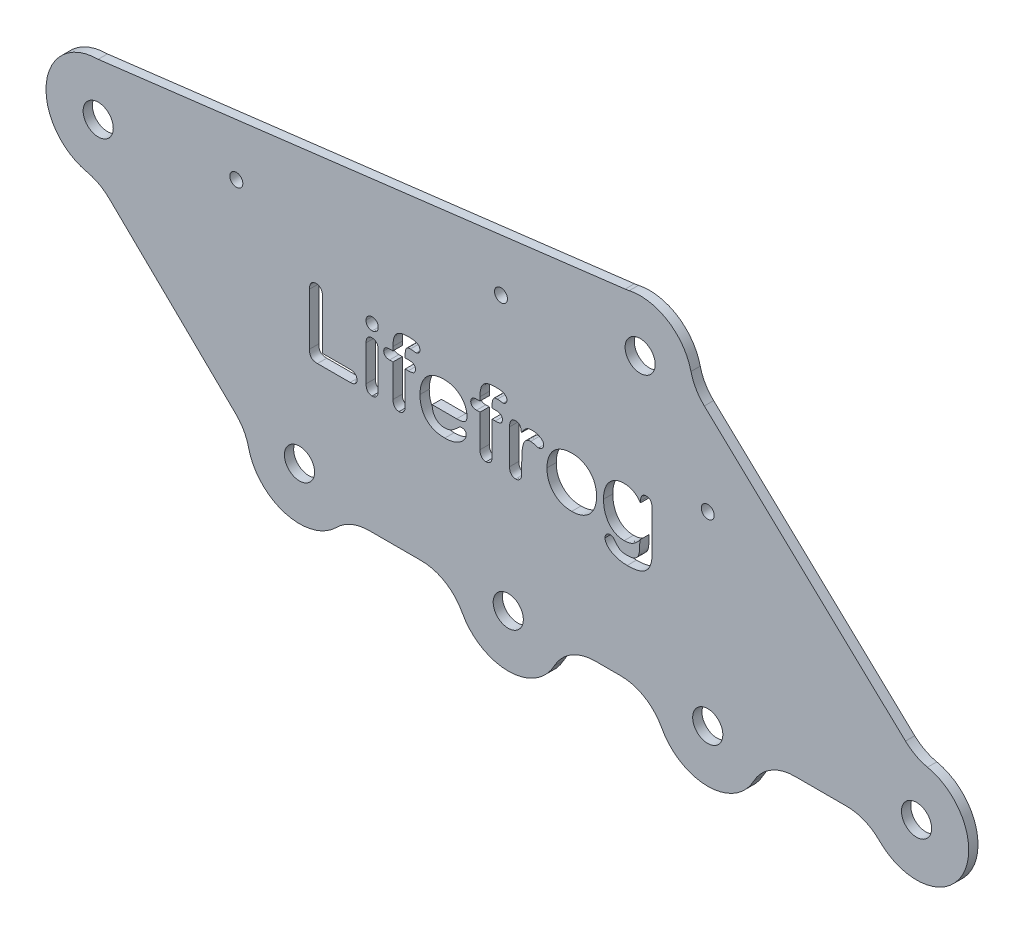
from build123d import *

# Parameters (mm, degrees)
SKETCH2_R               = 3.25
BOSS_EXTRUDE1_DEPTH     = 2
SKETCH7_R               = 1.4
CUT_EXTRUDE4_DEPTH      = 173.081521917
CUT_EXTRUDE5_DEPTH      = 173.081521917
CUT_EXTRUDE5_DEPTH_BACK = 173.081521917
SKETCH8_R               = 4.120030103
SKETCH8_R_2             = 3.620945825
CUT_EXTRUDE6_DEPTH      = 10


with BuildPart() as part:
    # Sketch2 → Boss-Extrude1 (new body)
    with BuildSketch(Plane.XY):
        with BuildLine():
            Line((-148.073115296, -13.584682462), (-120.825231203, -40.096785488))
            ThreePointArc((-120.825231203, -40.096785488), (-119.081817876, -42.363650366), (-118.051299446, -45.031270685))
            ThreePointArc((-118.051299446, -45.031270685), (-110.186182808, -53.333696022), (-99.116582089, -50.460672154))
            ThreePointArc((-99.116582089, -50.460672154), (-95.868116105, -48.284014232), (-92.03329116, -47.519495684))
            Line((-92.03329116, -47.519495684), (-80.835284384, -47.519495684))
            ThreePointArc((-80.835284384, -47.519495684), (-75.69032683, -48.944566427), (-72.011754972, -52.813613331))
            ThreePointArc((-72.011754972, -52.813613331), (-62.085284384, -58.769495684), (-52.158813796, -52.813613331))
            ThreePointArc((-52.158813796, -52.813613331), (-48.480241938, -48.944566427), (-43.335284384, -47.519495684))
            Line((-43.335284384, -47.519495684), (-37.835284384, -47.519495684))
            ThreePointArc((-37.835284384, -47.519495684), (-32.69032683, -48.944566427), (-29.011754972, -52.813613331))
            ThreePointArc((-29.011754972, -52.813613331), (-19.085284384, -58.769495684), (-9.158813796, -52.813613331))
            ThreePointArc((-9.158813796, -52.813613331), (-5.480241938, -48.944566427), (-0.335284384, -47.519495684))
            Line((-0.335284384, -47.519495684), (10.862722393, -47.519495684))
            ThreePointArc((10.862722393, -47.519495684), (14.697547337, -48.284014232), (17.946013321, -50.460672154))
            ThreePointArc((17.946013321, -50.460672154), (35.789142951, -47.910060108), (28.284854849, -31.521998695))
            ThreePointArc((28.284854849, -31.521998695), (25.737103371, -30.597165541), (23.531291017, -29.022127188))
            Line((23.531291017, -29.022127188), (-19.826212646, 11.860344126))
            ThreePointArc((-19.826212646, 11.860344126), (-21.632423973, 14.14697339), (-22.70275091, 16.857226699))
            ThreePointArc((-22.70275091, 16.857226699), (-27.630580825, 23.793458302), (-36.00543315, 25.295678347))
            ThreePointArc((-36.00543315, 25.295678347), (-36.440399397, 25.212847446), (-36.878605966, 25.149352578))
            Line((-36.878605966, 25.149352578), (-150.472591379, 11.25))
            ThreePointArc((-150.472591379, 11.25), (-161.656466294, 1.217966296), (-152.894206081, -10.986276996))
            ThreePointArc((-152.894206081, -10.986276996), (-150.302310001, -11.949001015), (-148.073115296, -13.584682462))
        make_face()
        with Locations((25.914715616, -42.519495684)):
            Circle(SKETCH2_R, mode=Mode.SUBTRACT)
        with Locations((-19.085284384, -47.519495684)):
            Circle(SKETCH2_R, mode=Mode.SUBTRACT)
        with Locations((-62.085284384, -47.519495684)):
            Circle(SKETCH2_R, mode=Mode.SUBTRACT)
        with Locations((-107.085284384, -42.519495684)):
            Circle(SKETCH2_R, mode=Mode.SUBTRACT)
        with Locations((-150.472591379, 0)):
            Circle(SKETCH2_R, mode=Mode.SUBTRACT)
        with Locations((-33.656755, 14.29357805)):
            Circle(SKETCH2_R, mode=Mode.SUBTRACT)
    extrude(amount=BOSS_EXTRUDE1_DEPTH)

    # Sketch7 → Cut-Extrude4 (cut, through all)
    with BuildSketch(Plane.XY.offset(2)):
        with Locations((-120.694679945, 3.643623283)):
            Circle(SKETCH7_R)
        with Locations((-63.656755, 10.622780025)):
            Circle(SKETCH7_R)
        with Locations((-19.085284384, -7.519495684)):
            Circle(SKETCH7_R)
    extrude(amount=-CUT_EXTRUDE4_DEPTH, mode=Mode.SUBTRACT)

    # Sketch5 → Cut-Extrude5 (cut, two sides: drawn at the far end of the back side and taken through both)
    # profile 1 of 9: a face of its own
    with BuildSketch(Plane.XY.offset(2).offset(-CUT_EXTRUDE5_DEPTH_BACK)):
        with BuildLine():
            Line((-102.115894244, -8.88917677), (-102.115894244, -19.477067395))
            Line((-102.115894244, -19.477067395), (-96.162769244, -19.477067395))
            add(Edge.make_bspline(
                [(-96.162769244, -19.477067395), (-96.051007313, -19.479993195), (-95.837884188, -19.485572515), (-95.539916783, -19.554542719), (-95.278875028, -19.661257744), (-95.067813968, -19.819951832), (-94.897692681, -20.005566477), (-94.774137444, -20.217869304), (-94.701867925, -20.454899643), (-94.69344353, -20.620129964), (-94.689136431, -20.704606457)],
                knots=[0, 0, 0, 0, 1.240270116, 2.365118784, 3.381765818, 4.352609133, 5.275186246, 6.165500839, 7.062084633, 8, 8, 8, 8], degree=3))
            add(Edge.make_bspline(
                [(-94.689136431, -20.704606457), (-94.693268201, -20.791061883), (-94.701260642, -20.958300126), (-94.774223839, -21.197153566), (-94.896313466, -21.407864411), (-95.064278317, -21.589554136), (-95.275076024, -21.739731647), (-95.534926018, -21.839448431), (-95.834238111, -21.905877279), (-96.049070498, -21.911559901), (-96.162769244, -21.914567395)],
                knots=[0, 0, 0, 0, 0.961785517, 1.860465312, 2.752861249, 3.654173772, 4.599371787, 5.609990076, 6.735101654, 8, 8, 8, 8], degree=3))
            Line((-96.162769244, -21.914567395), (-103.205737994, -21.914567395))
            add(Edge.make_bspline(
                [(-103.205737994, -21.914567395), (-103.348861132, -21.910822677), (-103.615411062, -21.903848583), (-103.983050705, -21.820051925), (-104.292130258, -21.691568649), (-104.538399287, -21.496286799), (-104.719909675, -21.2361672), (-104.844114456, -20.915092293), (-104.914328704, -20.530846545), (-104.923491067, -20.25471837), (-104.928394244, -20.106950207)],
                knots=[0, 0, 0, 0, 1.184943227, 2.206816713, 3.109923682, 3.939837529, 4.776053014, 5.71019795, 6.774627611, 8, 8, 8, 8], degree=3))
            Line((-104.928394244, -20.106950207), (-104.928394244, -8.88917677))
            add(Edge.make_bspline(
                [(-104.928394244, -8.88917677), (-104.924770448, -8.749162056), (-104.917946116, -8.485486372), (-104.845257533, -8.118037422), (-104.725580552, -7.804802622), (-104.557073154, -7.546892469), (-104.345359797, -7.348035389), (-104.103133358, -7.202614303), (-103.828238086, -7.118889739), (-103.635988236, -7.107793002), (-103.536792681, -7.102067395)],
                knots=[0, 0, 0, 0, 1.312227502, 2.471186598, 3.495416453, 4.440711492, 5.33513045, 6.197779038, 7.0701043, 8, 8, 8, 8], degree=3))
            add(Edge.make_bspline(
                [(-103.536792681, -7.102067395), (-103.435486672, -7.106162598), (-103.238729888, -7.114116312), (-102.960533725, -7.204196573), (-102.711018875, -7.34317393), (-102.496727467, -7.541754535), (-102.319699564, -7.795771782), (-102.199312355, -8.111096688), (-102.125957592, -8.481501141), (-102.119399349, -8.747181708), (-102.115894244, -8.88917677)],
                knots=[0, 0, 0, 0, 0.937651975, 1.821110013, 2.686129292, 3.571911612, 4.510265029, 5.535848738, 6.683015045, 8, 8, 8, 8], degree=3))
        make_face()
    # profile 2 of 9: a face of its own
    with BuildSketch(Plane.XY.offset(2).offset(-CUT_EXTRUDE5_DEPTH_BACK)):
        with BuildLine():
            Line((-90.115894244, -12.74464552), (-90.115894244, -20.476090832))
            add(Edge.make_bspline(
                [(-90.115894244, -20.476090832), (-90.119794378, -20.602435528), (-90.127150905, -20.84074997), (-90.197032734, -21.174236118), (-90.314116621, -21.460321774), (-90.479508659, -21.694972614), (-90.682688675, -21.876468441), (-90.91257444, -22.009165841), (-91.170561441, -22.087195916), (-91.35072121, -22.097028675), (-91.443042681, -22.102067395)],
                knots=[0, 0, 0, 0, 1.279660949, 2.41372764, 3.434282009, 4.393028164, 5.297478756, 6.175532382, 7.06506577, 8, 8, 8, 8], degree=3))
            add(Edge.make_bspline(
                [(-91.443042681, -22.102067395), (-91.535510198, -22.097531408), (-91.714376796, -22.08875712), (-91.96856286, -22.004912745), (-92.195763486, -21.871389965), (-92.391201556, -21.682373157), (-92.551255931, -21.445866625), (-92.661127298, -21.160395096), (-92.729043835, -20.832780478), (-92.736793903, -20.599508451), (-92.740894244, -20.476090832)],
                knots=[0, 0, 0, 0, 0.944656094, 1.82731652, 2.710883517, 3.62364324, 4.589202842, 5.612771424, 6.736985008, 8, 8, 8, 8], degree=3))
            Line((-92.740894244, -20.476090832), (-92.740894244, -12.823747082))
            add(Edge.make_bspline(
                [(-92.740894244, -12.823747082), (-92.736699871, -12.699382119), (-92.728769083, -12.464230884), (-92.662517274, -12.136087305), (-92.551799881, -11.854229206), (-92.391012747, -11.625466775), (-92.194397213, -11.44586487), (-91.968144037, -11.317596829), (-91.713355602, -11.241954113), (-91.535359197, -11.232151465), (-91.443042681, -11.227067395)],
                knots=[0, 0, 0, 0, 1.282601348, 2.425162879, 3.437763456, 4.38569495, 5.284727511, 6.164859808, 7.048218153, 8, 8, 8, 8], degree=3))
            add(Edge.make_bspline(
                [(-91.443042681, -11.227067395), (-91.350780374, -11.232364163), (-91.171013808, -11.242684541), (-90.912920439, -11.316791228), (-90.682617286, -11.446472242), (-90.482415238, -11.624386887), (-90.315350707, -11.846010703), (-90.198859156, -12.112795725), (-90.127488314, -12.416719887), (-90.119879855, -12.631916842), (-90.115894244, -12.74464552)],
                knots=[0, 0, 0, 0, 0.975882645, 1.901438153, 2.812865763, 3.75006033, 4.717368935, 5.725761173, 6.808663735, 8, 8, 8, 8], degree=3))
        make_face()
    # profile 3 of 9: a face of its own
    with BuildSketch(Plane.XY.offset(2).offset(-CUT_EXTRUDE5_DEPTH_BACK)):
        with BuildLine():
            add(Edge.make_bspline(
                [(-91.413745806, -9.914567395), (-91.502059692, -9.911112501), (-91.674377381, -9.904371326), (-91.923091601, -9.837014704), (-92.15078929, -9.726888524), (-92.357720239, -9.578448802), (-92.529720608, -9.386651845), (-92.655762931, -9.154497095), (-92.729492495, -8.885778489), (-92.73699213, -8.695310105), (-92.740894244, -8.59620802)],
                knots=[0, 0, 0, 0, 1.006201835, 1.963296869, 2.915511555, 3.880878732, 4.85189213, 5.829536295, 6.870691953, 8, 8, 8, 8], degree=3))
            add(Edge.make_bspline(
                [(-92.740894244, -8.59620802), (-92.735711958, -8.504891338), (-92.725668701, -8.327919822), (-92.650545078, -8.073896193), (-92.521388078, -7.848246813), (-92.347766447, -7.652100465), (-92.141388488, -7.494003153), (-91.916161531, -7.371969471), (-91.66963809, -7.303278473), (-91.500084931, -7.29419357), (-91.413745806, -7.289567395)],
                knots=[0, 0, 0, 0, 1.057408726, 2.04925565, 3.037480321, 4.047814229, 5.064214746, 6.036169889, 6.999986943, 8, 8, 8, 8], degree=3))
            add(Edge.make_bspline(
                [(-91.413745806, -7.289567395), (-91.330331688, -7.293289281), (-91.166969837, -7.300578386), (-90.929246738, -7.365176401), (-90.707981257, -7.471719022), (-90.506122496, -7.61868617), (-90.327667655, -7.801949122), (-90.205863506, -8.035133325), (-90.125225569, -8.302838261), (-90.119114728, -8.494958443), (-90.115894244, -8.59620802)],
                knots=[0, 0, 0, 0, 0.967133894, 1.894077239, 2.837452275, 3.803721558, 4.782485793, 5.777084342, 6.828497526, 8, 8, 8, 8], degree=3))
            add(Edge.make_bspline(
                [(-90.115894244, -8.59620802), (-90.119666741, -8.694407685), (-90.126915601, -8.883098506), (-90.202445242, -9.148438196), (-90.323346226, -9.381879948), (-90.497008149, -9.571319036), (-90.697722159, -9.722899361), (-90.920078487, -9.833786351), (-91.160369106, -9.904963009), (-91.328281937, -9.911327839), (-91.413745806, -9.914567395)],
                knots=[0, 0, 0, 0, 1.133982342, 2.178948973, 3.165031597, 4.149752721, 5.126395816, 6.06160272, 7.013399203, 8, 8, 8, 8], degree=3))
        make_face()
    # profile 4 of 9: a face of its own
    with BuildSketch(Plane.XY.offset(2).offset(-CUT_EXTRUDE5_DEPTH_BACK)):
        with BuildLine():
            Line((-87.569995806, -11.414567395), (-86.928394244, -11.414567395))
            Line((-86.928394244, -11.414567395), (-86.928394244, -10.591325207))
            add(Edge.make_bspline(
                [(-86.928394244, -10.591325207), (-86.924700914, -10.388045332), (-86.917705381, -10.00301306), (-86.859665412, -9.457909943), (-86.765573069, -8.978381027), (-86.632882133, -8.557808501), (-86.446581198, -8.195572563), (-86.205604775, -7.887535194), (-85.908437152, -7.633608774), (-85.553484837, -7.431434885), (-85.135146039, -7.280410479), (-84.649682076, -7.174729198), (-84.094123419, -7.111487828), (-83.700058626, -7.105323868), (-83.491870806, -7.102067395)],
                knots=[0, 0, 0, 0, 1.272338929, 2.409936283, 3.426662608, 4.327577154, 5.161578725, 5.96266415, 6.760383261, 7.592994418, 8.506024445, 9.533847079, 10.697110196, 12, 12, 12, 12], degree=3))
            add(Edge.make_bspline(
                [(-83.491870806, -7.102067395), (-83.307068191, -7.104261268), (-82.960801066, -7.108371958), (-82.478567661, -7.168286024), (-82.066452312, -7.255167266), (-81.72918291, -7.391161667), (-81.457325514, -7.558653085), (-81.264450259, -7.776533401), (-81.14794255, -8.037027657), (-81.134555018, -8.223910447), (-81.127612994, -8.320817395)],
                knots=[0, 0, 0, 0, 1.495564663, 2.802259462, 3.930374803, 4.895312065, 5.735498063, 6.492167842, 7.218122695, 8, 8, 8, 8], degree=3))
            add(Edge.make_bspline(
                [(-81.127612994, -8.320817395), (-81.13016044, -8.384563693), (-81.135172155, -8.509974928), (-81.182649106, -8.690669099), (-81.264942883, -8.855101057), (-81.371125512, -9.002344218), (-81.498609867, -9.125761707), (-81.641283549, -9.215318606), (-81.796289851, -9.272564588), (-81.904462105, -9.278650351), (-81.959644244, -9.281754895)],
                knots=[0, 0, 0, 0, 1.08569999, 2.135951137, 3.156332465, 4.20565892, 5.218674748, 6.161348951, 7.062045096, 8, 8, 8, 8], degree=3))
            add(Edge.make_bspline(
                [(-81.959644244, -9.281754895), (-81.990923875, -9.281243662), (-82.062451162, -9.280074624), (-82.184322966, -9.265550853), (-82.335069813, -9.249871502), (-82.562596635, -9.213428957), (-82.838380297, -9.175272517), (-83.05620293, -9.167906783), (-83.154956744, -9.164567395)],
                knots=[0, 0, 0, 0, 0.468218035, 1.070676523, 1.83620524, 2.737967929, 4.521099009, 6, 6, 6, 6], degree=3))
            add(Edge.make_bspline(
                [(-83.154956744, -9.164567395), (-83.266879767, -9.168513751), (-83.471705369, -9.175735811), (-83.748826522, -9.253609551), (-83.965776352, -9.387787922), (-84.108374405, -9.587280743), (-84.19515756, -9.82836939), (-84.25744231, -10.108223991), (-84.299579902, -10.432859402), (-84.302069643, -10.66441903), (-84.303394244, -10.78761427)],
                knots=[0, 0, 0, 0, 1.158634456, 2.120368021, 2.955008234, 3.751380872, 4.611223429, 5.599229928, 6.722733105, 8, 8, 8, 8], degree=3))
            Line((-84.303394244, -10.78761427), (-84.303394244, -11.414567395))
            Line((-84.303394244, -11.414567395), (-83.638355181, -11.414567395))
            add(Edge.make_bspline(
                [(-83.638355181, -11.414567395), (-83.518035883, -11.416649074), (-83.291972191, -11.420560268), (-82.976422378, -11.467875581), (-82.70599729, -11.540251074), (-82.484005335, -11.648680399), (-82.308648107, -11.789413733), (-82.185554218, -11.965226471), (-82.107884225, -12.172143548), (-82.10096014, -12.32106946), (-82.097339556, -12.398942395)],
                knots=[0, 0, 0, 0, 1.396050608, 2.622990337, 3.6962846, 4.634546857, 5.472373731, 6.277878481, 7.09950757, 8, 8, 8, 8], degree=3))
            add(Edge.make_bspline(
                [(-82.097339556, -12.398942395), (-82.101430239, -12.506003658), (-82.10888127, -12.701011923), (-82.184683124, -12.965095468), (-82.314039334, -13.171513058), (-82.509943835, -13.302589493), (-82.740907301, -13.37783369), (-83.005840503, -13.437731598), (-83.309405986, -13.470942071), (-83.525001195, -13.474956644), (-83.638355181, -13.477067395)],
                knots=[0, 0, 0, 0, 1.171181197, 2.133264703, 2.982673099, 3.781862637, 4.659228062, 5.636037739, 6.757094158, 8, 8, 8, 8], degree=3))
            Line((-83.638355181, -13.477067395), (-84.303394244, -13.477067395))
            Line((-84.303394244, -13.477067395), (-84.303394244, -20.49073927))
            add(Edge.make_bspline(
                [(-84.303394244, -20.49073927), (-84.307324323, -20.614179922), (-84.314789501, -20.848655192), (-84.385280454, -21.176561155), (-84.498848793, -21.461585314), (-84.664152095, -21.695052259), (-84.866845108, -21.875428653), (-85.095501488, -22.010618694), (-85.355317063, -22.086940159), (-85.537294849, -22.096942211), (-85.630542681, -22.102067395)],
                knots=[0, 0, 0, 0, 1.256538349, 2.386792053, 3.399650087, 4.363398215, 5.272567509, 6.146574889, 7.050280375, 8, 8, 8, 8], degree=3))
            add(Edge.make_bspline(
                [(-85.630542681, -22.102067395), (-85.719989993, -22.09710813), (-85.894515188, -22.087431855), (-86.145054229, -22.007724342), (-86.370556982, -21.876461922), (-86.570766574, -21.694722042), (-86.732567229, -21.460721404), (-86.846686793, -21.176665365), (-86.916946166, -20.8486244), (-86.924445947, -20.614169302), (-86.928394244, -20.49073927)],
                knots=[0, 0, 0, 0, 0.920542794, 1.796117823, 2.680158831, 3.592296685, 4.561321835, 5.585807508, 6.729036556, 8, 8, 8, 8], degree=3))
            Line((-86.928394244, -20.49073927), (-86.928394244, -13.477067395))
            Line((-86.928394244, -13.477067395), (-87.669605181, -13.477067395))
            add(Edge.make_bspline(
                [(-87.669605181, -13.477067395), (-87.764717637, -13.474545828), (-87.945069974, -13.469764431), (-88.197602841, -13.411306638), (-88.420159882, -13.326305771), (-88.603573939, -13.197615767), (-88.750908304, -13.041843238), (-88.850169927, -12.858126156), (-88.916372739, -12.656347119), (-88.923007314, -12.513757181), (-88.926441119, -12.43995802)],
                knots=[0, 0, 0, 0, 1.239726906, 2.350771435, 3.369360947, 4.331849643, 5.252604265, 6.143447782, 7.039118766, 8, 8, 8, 8], degree=3))
            add(Edge.make_bspline(
                [(-88.926441119, -12.43995802), (-88.923283957, -12.359364997), (-88.9172753, -12.205981751), (-88.850749549, -11.99217143), (-88.742401324, -11.809230275), (-88.589026748, -11.659732473), (-88.391857426, -11.547566221), (-88.154756492, -11.470404208), (-87.876811847, -11.419710271), (-87.676697567, -11.416355939), (-87.569995806, -11.414567395)],
                knots=[0, 0, 0, 0, 0.995382564, 1.894394861, 2.740686784, 3.604514537, 4.515167111, 5.524921804, 6.68027808, 8, 8, 8, 8], degree=3))
        make_face()
    # profile 5 of 9: a face of its own
    with BuildSketch(Plane.XY.offset(2).offset(-CUT_EXTRUDE5_DEPTH_BACK)):
        with BuildLine():
            Line((-73.208667681, -17.227067395), (-78.490894244, -17.227067395))
            add(Edge.make_bspline(
                [(-78.490894244, -17.227067395), (-78.485729032, -17.373895282), (-78.475607796, -17.661604604), (-78.399500086, -18.07799563), (-78.286354508, -18.469071713), (-78.128567635, -18.829619398), (-77.931660235, -19.153364248), (-77.709449566, -19.442705533), (-77.451707834, -19.684973297), (-77.165756761, -19.88267243), (-76.856444567, -20.033615445), (-76.531732066, -20.148105778), (-76.18967889, -20.212156224), (-75.956959932, -20.222066531), (-75.839527056, -20.227067395)],
                knots=[0, 0, 0, 0, 1.179639705, 2.311504614, 3.392005435, 4.44652888, 5.46432702, 6.431680492, 7.370191764, 8.295643874, 9.215452015, 10.129041871, 11.055891293, 12, 12, 12, 12], degree=3))
            add(Edge.make_bspline(
                [(-75.839527056, -20.227067395), (-75.684899945, -20.221290078), (-75.38699415, -20.210159454), (-74.953894078, -20.128402077), (-74.55183901, -19.976572402), (-74.172233727, -19.770423211), (-73.819626408, -19.521193305), (-73.535198858, -19.296133613), (-73.30788746, -19.094787244), (-73.116419912, -18.918875484), (-72.897546603, -18.722900775), (-72.746482696, -18.581855292), (-72.666675494, -18.507340832)],
                knots=[0, 0, 0, 0, 1.247905556, 2.404224554, 3.538983975, 4.702801183, 5.881313568, 7.020008393, 7.628790321, 8.331868978, 9.11872483, 10, 10, 10, 10], degree=3))
            add(Edge.make_bspline(
                [(-72.666675494, -18.507340832), (-72.629561272, -18.48027204), (-72.552305707, -18.423926662), (-72.410745358, -18.369543996), (-72.248164227, -18.338198915), (-72.132654468, -18.333846809), (-72.071948931, -18.331559582)],
                knots=[0, 0, 0, 0, 0.868866131, 1.808598965, 2.848320883, 4, 4, 4, 4], degree=3))
            add(Edge.make_bspline(
                [(-72.071948931, -18.331559582), (-72.005205088, -18.333900139), (-71.877920585, -18.33836372), (-71.698147996, -18.385198991), (-71.535535781, -18.453914722), (-71.397435702, -18.559309462), (-71.281141949, -18.686697731), (-71.200775579, -18.843467551), (-71.148932879, -19.021621344), (-71.145191899, -19.149522649), (-71.143237994, -19.216325207)],
                knots=[0, 0, 0, 0, 1.102465736, 2.102468148, 3.057950005, 4.00546365, 4.956145095, 5.889200524, 6.897534264, 8, 8, 8, 8], degree=3))
            add(Edge.make_bspline(
                [(-71.143237994, -19.216325207), (-71.147074427, -19.281058441), (-71.155207149, -19.418284177), (-71.211530831, -19.630580971), (-71.30468497, -19.856403047), (-71.430534653, -20.095129398), (-71.589870145, -20.341196211), (-71.792561168, -20.580823639), (-72.027283373, -20.819411181), (-72.299993333, -21.049528185), (-72.606870884, -21.269822809), (-72.952879871, -21.470546591), (-73.33797498, -21.646257285), (-73.755957021, -21.809324299), (-74.209350401, -21.941257019), (-74.697887614, -22.0333954), (-75.217872478, -22.094193404), (-75.576651345, -22.099400308), (-75.760425494, -22.102067395)],
                knots=[0, 0, 0, 0, 0.525537938, 1.114069654, 1.772306998, 2.506549159, 3.302753817, 4.147512317, 5.050313588, 6.017967943, 7.041213872, 8.114344659, 9.260276936, 10.47524946, 11.755151616, 13.087980653, 14.508401902, 16, 16, 16, 16], degree=3))
            add(Edge.make_bspline(
                [(-75.760425494, -22.102067395), (-75.970566234, -22.097519737), (-76.380250285, -22.088653761), (-76.975430681, -22.021353682), (-77.533004004, -21.908362258), (-78.051645226, -21.745772772), (-78.534701665, -21.542562166), (-78.978161462, -21.288395048), (-79.381535863, -20.987522623), (-79.746754804, -20.64373407), (-80.067772398, -20.257975864), (-80.351874822, -19.841633038), (-80.585884137, -19.388813691), (-80.780372736, -18.905299727), (-80.932098867, -18.389217889), (-81.040075091, -17.840151988), (-81.10545073, -17.258936562), (-81.112357264, -16.86005426), (-81.115894244, -16.655778332)],
                knots=[0, 0, 0, 0, 1.161895415, 2.265196273, 3.307380836, 4.303185105, 5.266158709, 6.199917451, 7.122316156, 8.043005893, 8.966794753, 9.89246016, 10.824859252, 11.779559524, 12.770652002, 13.794812853, 14.87067777, 16, 16, 16, 16], degree=3))
            add(Edge.make_bspline(
                [(-81.115894244, -16.655778332), (-81.112351374, -16.462226663), (-81.105370439, -16.080848933), (-81.038259091, -15.519624607), (-80.933763598, -14.979723953), (-80.788486547, -14.462108781), (-80.598046656, -13.975533109), (-80.372921593, -13.519340339), (-80.104117762, -13.102077052), (-79.799927638, -12.718106315), (-79.451233704, -12.376213514), (-79.061234287, -12.074737303), (-78.628998548, -11.817183613), (-78.157129599, -11.603132446), (-77.650787767, -11.433045112), (-77.112381625, -11.315293392), (-76.545831122, -11.238702527), (-76.158145954, -11.231007425), (-75.959644244, -11.227067395)],
                knots=[0, 0, 0, 0, 1.095507523, 2.15860795, 3.195309999, 4.206995944, 5.197887526, 6.149926361, 7.082497361, 8.003040645, 8.917987058, 9.840388418, 10.787726911, 11.760164811, 12.769081724, 13.806049167, 14.876658106, 16, 16, 16, 16], degree=3))
            add(Edge.make_bspline(
                [(-75.959644244, -11.227067395), (-75.82967599, -11.22810589), (-75.575169739, -11.23013949), (-75.200806959, -11.265268194), (-74.839711595, -11.313850777), (-74.491487894, -11.382379075), (-74.15967654, -11.478141357), (-73.841160582, -11.589179566), (-73.536096258, -11.720379466), (-73.247093024, -11.874248291), (-72.971225393, -12.038773815), (-72.717190296, -12.223475089), (-72.475441109, -12.411434191), (-72.254440606, -12.616494045), (-72.04918298, -12.831425773), (-71.86543806, -13.06140635), (-71.695754099, -13.299708893), (-71.501065769, -13.632045496), (-71.29721699, -14.058699678), (-71.115470707, -14.582630241), (-71.005629179, -15.115069491), (-70.991884998, -15.472667779), (-70.985034869, -15.65089552)],
                knots=[0, 0, 0, 0, 1.048847282, 2.053872234, 3.03283051, 3.989924751, 4.915857681, 5.818505585, 6.711913066, 7.593554535, 8.460263899, 9.302531452, 10.127499996, 10.930978608, 11.734070318, 12.524563272, 13.305443929, 14.093732096, 15.631266151, 17.114748765, 18.561984696, 20, 20, 20, 20], degree=3))
            add(Edge.make_bspline(
                [(-70.985034869, -15.65089552), (-70.986604018, -15.730068621), (-70.989597069, -15.881086234), (-71.015277956, -16.097314554), (-71.061442947, -16.291180146), (-71.127161718, -16.464024902), (-71.206726919, -16.617172785), (-71.3094301, -16.74579461), (-71.428239515, -16.854326494), (-71.620032975, -16.968584464), (-71.901445225, -17.07492862), (-72.285671015, -17.164445981), (-72.727625927, -17.219117531), (-73.042486482, -17.224321026), (-73.208667681, -17.227067395)],
                knots=[0, 0, 0, 0, 0.899856074, 1.716417764, 2.470354694, 3.159019517, 3.814679391, 4.423252287, 5.02068589, 5.633798556, 6.949059873, 8.421953477, 10.111532063, 12, 12, 12, 12], degree=3))
        make_face()
        with BuildLine():
            Line((-78.490894244, -15.727067395), (-73.595386431, -15.727067395))
            add(Edge.make_bspline(
                [(-73.595386431, -15.727067395), (-73.604322953, -15.620388862), (-73.621708392, -15.412852503), (-73.676971373, -15.113999216), (-73.741925544, -14.835108466), (-73.828072086, -14.577543089), (-73.929671959, -14.341165405), (-74.047709808, -14.123236857), (-74.184828665, -13.928050969), (-74.338373242, -13.753386376), (-74.507240019, -13.600302554), (-74.687703579, -13.465060191), (-74.88367525, -13.352382039), (-75.092871169, -13.262997606), (-75.31249975, -13.187447347), (-75.546992381, -13.140138129), (-75.792574806, -13.105158478), (-75.961461832, -13.103110926), (-76.047534869, -13.102067395)],
                knots=[0, 0, 0, 0, 1.274652096, 2.479755284, 3.617009281, 4.684005428, 5.71065458, 6.679155714, 7.63137599, 8.546404667, 9.444107911, 10.342338794, 11.228430864, 12.129821099, 13.049645363, 13.989847955, 14.975528821, 16, 16, 16, 16], degree=3))
            add(Edge.make_bspline(
                [(-76.047534869, -13.102067395), (-76.129637456, -13.10475237), (-76.290452304, -13.110011447), (-76.527254178, -13.138599654), (-76.752039842, -13.191199261), (-76.965729073, -13.265652746), (-77.168337697, -13.359118289), (-77.35978224, -13.474146939), (-77.539458013, -13.609700616), (-77.706839063, -13.766189336), (-77.862846038, -13.941320054), (-78.000334453, -14.138573533), (-78.120382782, -14.355594311), (-78.229866787, -14.589561112), (-78.320263624, -14.845787112), (-78.392374485, -15.122470817), (-78.451283959, -15.417941176), (-78.477480377, -15.622383021), (-78.490894244, -15.727067395)],
                knots=[0, 0, 0, 0, 0.988988761, 1.937138454, 2.867098831, 3.763434994, 4.657917626, 5.549380048, 6.447873833, 7.363218941, 8.304708192, 9.267190604, 10.251834605, 11.288414524, 12.374576878, 13.518478699, 14.729337904, 16, 16, 16, 16], degree=3))
        make_face(mode=Mode.SUBTRACT)
    # profile 6 of 9: a face of its own
    with BuildSketch(Plane.XY.offset(2).offset(-CUT_EXTRUDE5_DEPTH_BACK)):
        with BuildLine():
            Line((-68.819995806, -11.414567395), (-68.178394244, -11.414567395))
            Line((-68.178394244, -11.414567395), (-68.178394244, -10.591325207))
            add(Edge.make_bspline(
                [(-68.178394244, -10.591325207), (-68.174700914, -10.388045332), (-68.167705381, -10.00301306), (-68.109665412, -9.457909943), (-68.015573069, -8.978381027), (-67.882882133, -8.557808501), (-67.696581198, -8.195572563), (-67.455604775, -7.887535194), (-67.158437152, -7.633608774), (-66.803484837, -7.431434885), (-66.385146039, -7.280410479), (-65.899682076, -7.174729198), (-65.344123419, -7.111487828), (-64.950058626, -7.105323868), (-64.741870806, -7.102067395)],
                knots=[0, 0, 0, 0, 1.272338929, 2.409936283, 3.426662608, 4.327577154, 5.161578725, 5.96266415, 6.760383261, 7.592994418, 8.506024445, 9.533847079, 10.697110196, 12, 12, 12, 12], degree=3))
            add(Edge.make_bspline(
                [(-64.741870806, -7.102067395), (-64.557068191, -7.104261268), (-64.210801066, -7.108371958), (-63.728567661, -7.168286024), (-63.316452312, -7.255167266), (-62.97918291, -7.391161667), (-62.707325514, -7.558653085), (-62.514450259, -7.776533401), (-62.39794255, -8.037027657), (-62.384555018, -8.223910447), (-62.377612994, -8.320817395)],
                knots=[0, 0, 0, 0, 1.495564663, 2.802259462, 3.930374803, 4.895312065, 5.735498063, 6.492167842, 7.218122695, 8, 8, 8, 8], degree=3))
            add(Edge.make_bspline(
                [(-62.377612994, -8.320817395), (-62.38016044, -8.384563693), (-62.385172155, -8.509974928), (-62.432649106, -8.690669099), (-62.514942883, -8.855101057), (-62.621125512, -9.002344218), (-62.748609867, -9.125761707), (-62.891283549, -9.215318606), (-63.046289851, -9.272564588), (-63.154462105, -9.278650351), (-63.209644244, -9.281754895)],
                knots=[0, 0, 0, 0, 1.08569999, 2.135951137, 3.156332465, 4.20565892, 5.218674748, 6.161348951, 7.062045096, 8, 8, 8, 8], degree=3))
            add(Edge.make_bspline(
                [(-63.209644244, -9.281754895), (-63.240923875, -9.281243662), (-63.312451162, -9.280074624), (-63.434322966, -9.265550853), (-63.585069813, -9.249871502), (-63.812596635, -9.213428957), (-64.088380297, -9.175272517), (-64.30620293, -9.167906783), (-64.404956744, -9.164567395)],
                knots=[0, 0, 0, 0, 0.468218035, 1.070676523, 1.83620524, 2.737967929, 4.521099009, 6, 6, 6, 6], degree=3))
            add(Edge.make_bspline(
                [(-64.404956744, -9.164567395), (-64.516879767, -9.168513751), (-64.721705369, -9.175735811), (-64.998826522, -9.253609551), (-65.215776352, -9.387787922), (-65.358374405, -9.587280743), (-65.44515756, -9.82836939), (-65.50744231, -10.108223991), (-65.549579902, -10.432859402), (-65.552069643, -10.66441903), (-65.553394244, -10.78761427)],
                knots=[0, 0, 0, 0, 1.158634456, 2.120368021, 2.955008234, 3.751380872, 4.611223429, 5.599229928, 6.722733105, 8, 8, 8, 8], degree=3))
            Line((-65.553394244, -10.78761427), (-65.553394244, -11.414567395))
            Line((-65.553394244, -11.414567395), (-64.888355181, -11.414567395))
            add(Edge.make_bspline(
                [(-64.888355181, -11.414567395), (-64.768035883, -11.416649074), (-64.541972191, -11.420560268), (-64.226422378, -11.467875581), (-63.95599729, -11.540251074), (-63.734005335, -11.648680399), (-63.558648107, -11.789413733), (-63.435554218, -11.965226471), (-63.357884225, -12.172143548), (-63.35096014, -12.32106946), (-63.347339556, -12.398942395)],
                knots=[0, 0, 0, 0, 1.396050608, 2.622990337, 3.6962846, 4.634546857, 5.472373731, 6.277878481, 7.09950757, 8, 8, 8, 8], degree=3))
            add(Edge.make_bspline(
                [(-63.347339556, -12.398942395), (-63.351430239, -12.506003658), (-63.35888127, -12.701011923), (-63.434683124, -12.965095468), (-63.564039334, -13.171513058), (-63.759943835, -13.302589493), (-63.990907301, -13.37783369), (-64.255840503, -13.437731598), (-64.559405986, -13.470942071), (-64.775001195, -13.474956644), (-64.888355181, -13.477067395)],
                knots=[0, 0, 0, 0, 1.171181197, 2.133264703, 2.982673099, 3.781862637, 4.659228062, 5.636037739, 6.757094158, 8, 8, 8, 8], degree=3))
            Line((-64.888355181, -13.477067395), (-65.553394244, -13.477067395))
            Line((-65.553394244, -13.477067395), (-65.553394244, -20.49073927))
            add(Edge.make_bspline(
                [(-65.553394244, -20.49073927), (-65.557324323, -20.614179922), (-65.564789501, -20.848655192), (-65.635280454, -21.176561155), (-65.748848793, -21.461585314), (-65.914152095, -21.695052259), (-66.116845108, -21.875428653), (-66.345501488, -22.010618694), (-66.605317063, -22.086940159), (-66.787294849, -22.096942211), (-66.880542681, -22.102067395)],
                knots=[0, 0, 0, 0, 1.256538349, 2.386792053, 3.399650087, 4.363398215, 5.272567509, 6.146574889, 7.050280375, 8, 8, 8, 8], degree=3))
            add(Edge.make_bspline(
                [(-66.880542681, -22.102067395), (-66.969989993, -22.09710813), (-67.144515188, -22.087431855), (-67.395054229, -22.007724342), (-67.620556982, -21.876461922), (-67.820766574, -21.694722042), (-67.982567229, -21.460721404), (-68.096686793, -21.176665365), (-68.166946166, -20.8486244), (-68.174445947, -20.614169302), (-68.178394244, -20.49073927)],
                knots=[0, 0, 0, 0, 0.920542794, 1.796117823, 2.680158831, 3.592296685, 4.561321835, 5.585807508, 6.729036556, 8, 8, 8, 8], degree=3))
            Line((-68.178394244, -20.49073927), (-68.178394244, -13.477067395))
            Line((-68.178394244, -13.477067395), (-68.919605181, -13.477067395))
            add(Edge.make_bspline(
                [(-68.919605181, -13.477067395), (-69.014717637, -13.474545828), (-69.195069974, -13.469764431), (-69.447602841, -13.411306638), (-69.670159882, -13.326305771), (-69.853573939, -13.197615767), (-70.000908304, -13.041843238), (-70.100169927, -12.858126156), (-70.166372739, -12.656347119), (-70.173007314, -12.513757181), (-70.176441119, -12.43995802)],
                knots=[0, 0, 0, 0, 1.239726906, 2.350771435, 3.369360947, 4.331849643, 5.252604265, 6.143447782, 7.039118766, 8, 8, 8, 8], degree=3))
            add(Edge.make_bspline(
                [(-70.176441119, -12.43995802), (-70.173283957, -12.359364997), (-70.1672753, -12.205981751), (-70.100749549, -11.99217143), (-69.992401324, -11.809230275), (-69.839026748, -11.659732473), (-69.641857426, -11.547566221), (-69.404756492, -11.470404208), (-69.126811847, -11.419710271), (-68.926697567, -11.416355939), (-68.819995806, -11.414567395)],
                knots=[0, 0, 0, 0, 0.995382564, 1.894394861, 2.740686784, 3.604514537, 4.515167111, 5.524921804, 6.68027808, 8, 8, 8, 8], degree=3))
        make_face()
    # profile 7 of 9: a face of its own
    with BuildSketch(Plane.XY.offset(2).offset(-CUT_EXTRUDE5_DEPTH_BACK)):
        with BuildLine():
            Line((-59.178394244, -18.21730177), (-59.178394244, -20.464372082))
            add(Edge.make_bspline(
                [(-59.178394244, -20.464372082), (-59.182322559, -20.592663462), (-59.189737847, -20.83483283), (-59.259216665, -21.173173015), (-59.375819591, -21.46268977), (-59.542206957, -21.697626109), (-59.744323108, -21.879946249), (-59.975989208, -22.008518529), (-60.232941334, -22.08740627), (-60.413180516, -22.097099946), (-60.505542681, -22.102067395)],
                knots=[0, 0, 0, 0, 1.292414504, 2.439627698, 3.46375878, 4.417332263, 5.316903122, 6.185375834, 7.070109971, 8, 8, 8, 8], degree=3))
            add(Edge.make_bspline(
                [(-60.505542681, -22.102067395), (-60.596898089, -22.09710505), (-60.774228669, -22.087472609), (-61.02762995, -22.009227395), (-61.251604297, -21.875274697), (-61.451984506, -21.695716107), (-61.610499532, -21.458957778), (-61.725504258, -21.174115576), (-61.791218668, -20.840355995), (-61.799173407, -20.602368539), (-61.803394244, -20.476090832)],
                knots=[0, 0, 0, 0, 0.933294383, 1.81162385, 2.680186499, 3.585258456, 4.541104918, 5.566887721, 6.708974649, 8, 8, 8, 8], degree=3))
            Line((-61.803394244, -20.476090832), (-61.803394244, -13.028825207))
            add(Edge.make_bspline(
                [(-61.803394244, -13.028825207), (-61.799730251, -12.887967816), (-61.792849053, -12.623429237), (-61.735776236, -12.253599122), (-61.639567719, -11.937580399), (-61.496254001, -11.678454634), (-61.315514017, -11.470839169), (-61.086826968, -11.325648529), (-60.817640573, -11.24325969), (-60.626241318, -11.232631094), (-60.526050494, -11.227067395)],
                knots=[0, 0, 0, 0, 1.34619872, 2.528241455, 3.567694465, 4.487339067, 5.340335725, 6.171799567, 7.043000931, 8, 8, 8, 8], degree=3))
            add(Edge.make_bspline(
                [(-60.526050494, -11.227067395), (-60.423964078, -11.23166171), (-60.232140874, -11.240294554), (-59.96573528, -11.31618665), (-59.744757761, -11.448839438), (-59.574502888, -11.63900255), (-59.444204249, -11.876050227), (-59.349609385, -12.159893812), (-59.290006047, -12.492418163), (-59.274520952, -12.729745798), (-59.266284869, -12.855973645)],
                knots=[0, 0, 0, 0, 1.044883286, 1.963364657, 2.807970932, 3.650974255, 4.547373518, 5.563477854, 6.704082887, 8, 8, 8, 8], degree=3))
            add(Edge.make_bspline(
                [(-59.266284869, -12.855973645), (-59.187154757, -12.728702257), (-59.035804418, -12.485273209), (-58.787956133, -12.155879517), (-58.540962339, -11.872664951), (-58.284149984, -11.635812705), (-58.002222316, -11.445181426), (-57.676391936, -11.317799074), (-57.309909313, -11.240889927), (-57.051850669, -11.231818927), (-56.916675494, -11.227067395)],
                knots=[0, 0, 0, 0, 1.18924255, 2.274636787, 3.268721947, 4.168850259, 5.041860026, 5.953170485, 6.927838526, 8, 8, 8, 8], degree=3))
            add(Edge.make_bspline(
                [(-56.916675494, -11.227067395), (-56.775747725, -11.232489358), (-56.492853461, -11.243373249), (-56.073052378, -11.320929872), (-55.660920655, -11.453132582), (-55.328766913, -11.600397905), (-55.080670801, -11.742608322), (-54.915701672, -11.857020394), (-54.778751657, -11.98382965), (-54.661785388, -12.115426572), (-54.572123596, -12.257833616), (-54.510761789, -12.409798496), (-54.470136727, -12.569674136), (-54.466414535, -12.679941298), (-54.464527056, -12.735856457)],
                knots=[0, 0, 0, 0, 1.609451603, 3.230765888, 4.857137694, 6.544750347, 7.369389467, 8.121503283, 8.832102741, 9.496362917, 10.127778221, 10.743023735, 11.362602371, 12, 12, 12, 12], degree=3))
            add(Edge.make_bspline(
                [(-54.464527056, -12.735856457), (-54.467767369, -12.813574254), (-54.474044563, -12.9641306), (-54.543416205, -13.177988977), (-54.648650468, -13.372817877), (-54.799251598, -13.536083886), (-54.970071927, -13.670264449), (-55.15351986, -13.768279515), (-55.34434546, -13.830801857), (-55.474819056, -13.839133704), (-55.539722369, -13.843278332)],
                knots=[0, 0, 0, 0, 1.088483127, 2.10862957, 3.128406662, 4.178128692, 5.204900727, 6.16884502, 7.089102868, 8, 8, 8, 8], degree=3))
            add(Edge.make_bspline(
                [(-55.539722369, -13.843278332), (-55.573036344, -13.840040056), (-55.659230674, -13.831661558), (-55.81195832, -13.792022204), (-56.018474751, -13.737267753), (-56.263119245, -13.659990651), (-56.524940328, -13.576472525), (-56.786413638, -13.523477689), (-57.029774565, -13.484406004), (-57.187045252, -13.479444147), (-57.262378619, -13.477067395)],
                knots=[0, 0, 0, 0, 0.454029574, 1.174725489, 2.136679894, 3.357464208, 4.658256254, 5.865202561, 6.977422421, 8, 8, 8, 8], degree=3))
            add(Edge.make_bspline(
                [(-57.262378619, -13.477067395), (-57.356325896, -13.48141761), (-57.53814264, -13.489836608), (-57.799778543, -13.542788927), (-58.031283068, -13.646030446), (-58.238408899, -13.78176069), (-58.417017735, -13.961357491), (-58.574777615, -14.175620461), (-58.709682748, -14.42885195), (-58.822549933, -14.716376161), (-58.914044921, -15.037011302), (-58.992795855, -15.386257938), (-59.057640423, -15.764579045), (-59.102562652, -16.17561647), (-59.138042073, -16.623081436), (-59.159869077, -17.113612554), (-59.17481521, -17.649826852), (-59.177168503, -18.022954037), (-59.178394244, -18.21730177)],
                knots=[0, 0, 0, 0, 0.794050632, 1.536731085, 2.238662641, 2.922771156, 3.616952249, 4.366019506, 5.163320251, 6.033432924, 6.970572952, 7.977209821, 9.05675488, 10.211001348, 11.468820729, 12.84806026, 14.358274693, 16, 16, 16, 16], degree=3))
        make_face()
    # profile 8 of 9: a face of its own
    with BuildSketch(Plane.XY.offset(2).offset(-CUT_EXTRUDE5_DEPTH_BACK)):
        with BuildLine():
            add(Edge.make_bspline(
                [(-43.053394244, -16.67042677), (-43.057728542, -16.865958198), (-43.066252796, -17.250509443), (-43.138520017, -17.815248603), (-43.254958537, -18.356735194), (-43.419004374, -18.872727585), (-43.626659138, -19.359535852), (-43.875574702, -19.813005753), (-44.168674914, -20.230278447), (-44.502042283, -20.609939276), (-44.87324689, -20.9531364), (-45.282555715, -21.251299839), (-45.724083256, -21.51184656), (-46.201220039, -21.724708392), (-46.709713134, -21.896725611), (-47.251272277, -22.014013606), (-47.821725836, -22.090278252), (-48.212318248, -22.098082029), (-48.411792681, -22.102067395)],
                knots=[0, 0, 0, 0, 1.091425222, 2.14650367, 3.173246554, 4.180341516, 5.164818684, 6.123963105, 7.063390915, 8.006199165, 8.940071845, 9.880179878, 10.828459563, 11.797350195, 12.792281962, 13.820196984, 14.886780802, 16, 16, 16, 16], degree=3))
            add(Edge.make_bspline(
                [(-48.411792681, -22.102067395), (-48.610344042, -22.098480665), (-48.998254853, -22.091473252), (-49.563292355, -22.010038917), (-50.100636847, -21.894122427), (-50.604396012, -21.719498742), (-51.077288647, -21.501305834), (-51.517614652, -21.240748892), (-51.924440792, -20.936460383), (-52.297338455, -20.593622978), (-52.632320931, -20.211571465), (-52.925158164, -19.794745386), (-53.17711555, -19.345794671), (-53.380776906, -18.863747925), (-53.543433899, -18.352053245), (-53.654803996, -17.811904116), (-53.728424871, -17.246665517), (-53.736684315, -16.861096277), (-53.740894244, -16.664567395)],
                knots=[0, 0, 0, 0, 1.111227023, 2.171009928, 3.19145726, 4.186070048, 5.150303806, 6.104321695, 7.046220171, 7.990735544, 8.936485474, 9.886464991, 10.839039205, 11.814379169, 12.812535149, 13.84133354, 14.899703965, 16, 16, 16, 16], degree=3))
            add(Edge.make_bspline(
                [(-53.740894244, -16.664567395), (-53.736700746, -16.466082785), (-53.728472249, -16.076615619), (-53.654590223, -15.505610155), (-53.544112506, -14.959085186), (-53.377821625, -14.441866346), (-53.170830632, -13.954809255), (-52.92123104, -13.502415749), (-52.633194558, -13.085777538), (-52.302944444, -12.708353762), (-51.932691252, -12.371342104), (-51.525626431, -12.072840001), (-51.080841111, -11.818014706), (-50.601976981, -11.604092229), (-50.092089188, -11.43336561), (-49.553755433, -11.31556227), (-48.991147822, -11.238923762), (-48.607363765, -11.231069711), (-48.411792681, -11.227067395)],
                knots=[0, 0, 0, 0, 1.109458584, 2.176983352, 3.214831729, 4.223461232, 5.209438476, 6.170044374, 7.10777617, 8.036608407, 8.968213882, 9.902121437, 10.853822319, 11.829170779, 12.830797886, 13.854949514, 14.906911741, 16, 16, 16, 16], degree=3))
            add(Edge.make_bspline(
                [(-48.411792681, -11.227067395), (-48.213316098, -11.231174927), (-47.823742276, -11.239237275), (-47.253775827, -11.31420497), (-46.711772293, -11.436140384), (-46.200848862, -11.60975716), (-45.721742278, -11.827861391), (-45.273892295, -12.083355331), (-44.866964201, -12.389972109), (-44.495182015, -12.732556775), (-44.157821686, -13.110969179), (-43.868845789, -13.530134072), (-43.617129887, -13.980402785), (-43.413174455, -14.465390299), (-43.252487288, -14.979606196), (-43.13448504, -15.519473979), (-43.067060918, -16.08667861), (-43.058016766, -16.472983807), (-43.053394244, -16.67042677)],
                knots=[0, 0, 0, 0, 1.106546112, 2.171950929, 3.199928065, 4.200661522, 5.175688508, 6.132331741, 7.070262582, 8.010799296, 8.948477062, 9.891329305, 10.844648531, 11.82089183, 12.82003801, 13.845645933, 14.898896381, 16, 16, 16, 16], degree=3))
        make_face()
        with BuildLine():
            add(Edge.make_bspline(
                [(-45.678394244, -16.67042677), (-45.680550821, -16.540471396), (-45.684742653, -16.287871443), (-45.71979123, -15.920543914), (-45.779965908, -15.575532262), (-45.854973831, -15.250399141), (-45.963867494, -14.950063385), (-46.087098522, -14.668872274), (-46.242442614, -14.413974861), (-46.413343723, -14.178150822), (-46.608156081, -13.971012519), (-46.816037418, -13.786309146), (-47.044016544, -13.634549), (-47.285452468, -13.505920097), (-47.545242312, -13.41067581), (-47.819684902, -13.338976081), (-48.110785633, -13.298458846), (-48.310110903, -13.292570974), (-48.411792681, -13.289567395)],
                knots=[0, 0, 0, 0, 1.270558422, 2.469640054, 3.603049319, 4.693866399, 5.726721989, 6.722451407, 7.690273023, 8.639449843, 9.565088081, 10.465156222, 11.352368502, 12.23649231, 13.133922735, 14.051050542, 15.005782631, 16, 16, 16, 16], degree=3))
            add(Edge.make_bspline(
                [(-48.411792681, -13.289567395), (-48.543111346, -13.293167537), (-48.799328213, -13.300191802), (-49.170318685, -13.381687907), (-49.519846121, -13.501977975), (-49.840915922, -13.680841795), (-50.132554818, -13.904384313), (-50.393040962, -14.175320472), (-50.610576802, -14.498289914), (-50.796625447, -14.862686984), (-50.936890123, -15.26874037), (-51.043628706, -15.706832305), (-51.104729108, -16.178473495), (-51.112100331, -16.503261048), (-51.115894244, -16.67042677)],
                knots=[0, 0, 0, 0, 0.966943267, 1.886610523, 2.788820013, 3.685057501, 4.584069546, 5.490925344, 6.443978365, 7.44584051, 8.500680597, 9.604835001, 10.767226511, 12, 12, 12, 12], degree=3))
            add(Edge.make_bspline(
                [(-51.115894244, -16.67042677), (-51.112239102, -16.835677251), (-51.10513963, -17.156647376), (-51.042089134, -17.622697678), (-50.941631104, -18.057364566), (-50.797752988, -18.457425943), (-50.618113003, -18.819204405), (-50.398071839, -19.136915148), (-50.145833327, -19.412930615), (-49.855148218, -19.640114593), (-49.534605507, -19.820805111), (-49.183815764, -19.946385134), (-48.806878939, -20.025112761), (-48.545984101, -20.034657865), (-48.411792681, -20.039567395)],
                knots=[0, 0, 0, 0, 1.221452891, 2.372458373, 3.470695752, 4.514597835, 5.509283355, 6.448751658, 7.363470559, 8.263476682, 9.165479573, 10.07241203, 11.008543944, 12, 12, 12, 12], degree=3))
            add(Edge.make_bspline(
                [(-48.411792681, -20.039567395), (-48.310109982, -20.036565161), (-48.110782906, -20.030679926), (-47.819695134, -19.990143766), (-47.545205906, -19.918512142), (-47.285584494, -19.823021901), (-47.043042941, -19.695037632), (-46.816977731, -19.539497593), (-46.607976805, -19.355423123), (-46.413521808, -19.147917518), (-46.241402341, -18.911868837), (-46.088788306, -18.65546104), (-45.962933193, -18.375603349), (-45.855636029, -18.076574149), (-45.779828199, -17.753673501), (-45.719818165, -17.41152253), (-45.684824819, -17.048105533), (-45.680573698, -16.798429867), (-45.678394244, -16.67042677)],
                knots=[0, 0, 0, 0, 0.996858043, 1.954125933, 2.873689662, 3.773503692, 4.659975762, 5.554937906, 6.457396659, 7.385493423, 8.337191288, 9.315813857, 10.305473609, 11.341072498, 12.425486328, 13.552469893, 14.745206377, 16, 16, 16, 16], degree=3))
        make_face(mode=Mode.SUBTRACT)
    # profile 9 of 9: a face of its own
    with BuildSketch(Plane.XY.offset(2).offset(-CUT_EXTRUDE5_DEPTH_BACK)):
        with BuildLine():
            Line((-31.053394244, -13.24855177), (-31.053394244, -21.073747082))
            add(Edge.make_bspline(
                [(-31.053394244, -21.073747082), (-31.056636332, -21.289668532), (-31.062910855, -21.707548589), (-31.114567755, -22.310838809), (-31.204902352, -22.867172203), (-31.32998955, -23.377416774), (-31.491896332, -23.84506679), (-31.703317384, -24.267423187), (-31.950908523, -24.653258133), (-32.25147075, -24.991966607), (-32.593725534, -25.293090564), (-32.99058638, -25.544239225), (-33.430389351, -25.762432035), (-33.923565309, -25.935378901), (-34.470868163, -26.064718882), (-35.075853195, -26.161485854), (-35.743846614, -26.21486082), (-36.20955278, -26.222879134), (-36.452808306, -26.227067395)],
                knots=[0, 0, 0, 0, 1.193077057, 2.309002223, 3.342578962, 4.304588778, 5.20921544, 6.070806415, 6.909010715, 7.734982653, 8.56501699, 9.419735828, 10.32236431, 11.273091887, 12.300564439, 13.426427611, 14.655728113, 16, 16, 16, 16], degree=3))
            add(Edge.make_bspline(
                [(-36.452808306, -26.227067395), (-36.678615547, -26.22202945), (-37.119839751, -26.212185377), (-37.762901684, -26.134772632), (-38.369093881, -26.009911299), (-38.933884579, -25.836151213), (-39.445505258, -25.61584198), (-39.905058121, -25.373194016), (-40.29717105, -25.092286158), (-40.628497787, -24.789883295), (-40.886656798, -24.464949316), (-41.075773018, -24.133851937), (-41.196213647, -23.795706697), (-41.211754653, -23.565867789), (-41.219409869, -23.452653332)],
                knots=[0, 0, 0, 0, 1.351069114, 2.639970243, 3.869855339, 5.051064834, 6.169170093, 7.199517556, 8.154742545, 9.047991741, 9.875849639, 10.626865665, 11.323619059, 12, 12, 12, 12], degree=3))
            add(Edge.make_bspline(
                [(-41.219409869, -23.452653332), (-41.215852632, -23.370162444), (-41.208967872, -23.210507621), (-41.145098923, -22.984868315), (-41.044846788, -22.781008156), (-40.898353383, -22.611745282), (-40.731626768, -22.464836911), (-40.537103894, -22.367013987), (-40.329282713, -22.299769261), (-40.183837093, -22.293031512), (-40.109058306, -22.289567395)],
                knots=[0, 0, 0, 0, 1.100593589, 2.130114972, 3.111132825, 4.112532503, 5.103922639, 6.06172617, 7.003464206, 8, 8, 8, 8], degree=3))
            add(Edge.make_bspline(
                [(-40.109058306, -22.289567395), (-40.015001986, -22.297807486), (-39.824075375, -22.314534196), (-39.553332275, -22.444243677), (-39.305790507, -22.652776613), (-39.172624783, -22.834019726), (-39.101245806, -22.931168957)],
                knots=[0, 0, 0, 0, 0.904802776, 1.836675377, 2.840423108, 4, 4, 4, 4], degree=3))
            add(Edge.make_bspline(
                [(-39.101245806, -22.931168957), (-39.027077145, -23.022999385), (-38.87709818, -23.208692807), (-38.651554699, -23.486189079), (-38.407900523, -23.746512382), (-38.132936585, -23.974281206), (-37.806930068, -24.146027838), (-37.430123044, -24.269467496), (-36.995551834, -24.341146724), (-36.686486851, -24.348291041), (-36.523120806, -24.352067395)],
                knots=[0, 0, 0, 0, 0.914657093, 1.849559125, 2.770081465, 3.674097889, 4.601683639, 5.60665287, 6.734920882, 8, 8, 8, 8], degree=3))
            add(Edge.make_bspline(
                [(-36.523120806, -24.352067395), (-36.356862931, -24.349772775), (-36.041731922, -24.345423472), (-35.600614932, -24.285053864), (-35.214730943, -24.198980643), (-34.886858541, -24.065654609), (-34.611434263, -23.897104225), (-34.379670225, -23.700428003), (-34.19249607, -23.473887214), (-34.055241428, -23.215432589), (-33.95318417, -22.942063458), (-33.872838151, -22.657754766), (-33.817839065, -22.364576568), (-33.790328545, -22.110415408), (-33.781368299, -21.891048453), (-33.767740039, -21.702786676), (-33.759306688, -21.489822304), (-33.755478182, -21.254357994), (-33.744280697, -20.995690136), (-33.740029602, -20.713390218), (-33.73375886, -20.407737957), (-33.73009166, -20.195818841), (-33.728198931, -20.086442395)],
                knots=[0, 0, 0, 0, 1.649040383, 3.12564899, 4.411803224, 5.563945921, 6.621369587, 7.604506927, 8.568970364, 9.519051572, 10.494848921, 11.461599492, 12.448362545, 13.452543324, 13.996197049, 14.627512153, 15.326100287, 16.111569937, 16.965155253, 17.896000539, 18.914076333, 20, 20, 20, 20], degree=3))
            add(Edge.make_bspline(
                [(-33.728198931, -20.086442395), (-33.832928317, -20.228243024), (-34.037866965, -20.505724162), (-34.384686274, -20.877376), (-34.759370493, -21.192720198), (-35.157866062, -21.45735916), (-35.587898385, -21.66752994), (-36.057926063, -21.808776911), (-36.564549906, -21.899353304), (-36.916265791, -21.909396738), (-37.097339556, -21.914567395)],
                knots=[0, 0, 0, 0, 1.055738715, 2.065911711, 3.03769406, 3.983909981, 4.926118454, 5.894140725, 6.915841209, 8, 8, 8, 8], degree=3))
            add(Edge.make_bspline(
                [(-37.097339556, -21.914567395), (-37.207773744, -21.912166001), (-37.426178789, -21.90741678), (-37.748158523, -21.874236458), (-38.060906555, -21.822584081), (-38.362149492, -21.745500132), (-38.653926012, -21.6498829), (-38.933039016, -21.527797069), (-39.202919209, -21.38790609), (-39.461224504, -21.225864527), (-39.70702532, -21.04571704), (-39.935167027, -20.843687043), (-40.154830844, -20.630613496), (-40.354691145, -20.395110591), (-40.545455247, -20.146190033), (-40.712562238, -19.874613587), (-40.872680604, -19.590507719), (-41.064769831, -19.184568503), (-41.264077417, -18.639859379), (-41.433248304, -17.942277255), (-41.533115765, -17.195772906), (-41.546507409, -16.682454565), (-41.553394244, -16.418473645)],
                knots=[0, 0, 0, 0, 0.833112071, 1.647640849, 2.439835632, 3.222550966, 3.991445903, 4.753817451, 5.518393315, 6.283004681, 7.052252564, 7.814695319, 8.580583639, 9.358986843, 10.142949644, 10.944274693, 11.762261925, 12.602672888, 14.330023006, 16.127783965, 18.00866038, 20, 20, 20, 20], degree=3))
            add(Edge.make_bspline(
                [(-41.553394244, -16.418473645), (-41.549572698, -16.221051999), (-41.542080525, -15.834005236), (-41.480173825, -15.269528036), (-41.37727574, -14.734584178), (-41.235954554, -14.230525635), (-41.049738282, -13.76221528), (-40.834421182, -13.327108628), (-40.577679204, -12.933618383), (-40.289713665, -12.577509314), (-39.972847077, -12.259884554), (-39.629798777, -11.984063386), (-39.263256672, -11.750329511), (-38.874104361, -11.559102539), (-38.46362355, -11.409212488), (-38.032154527, -11.304717183), (-37.58188231, -11.237447396), (-37.274343025, -11.230568047), (-37.117847369, -11.227067395)],
                knots=[0, 0, 0, 0, 1.233131348, 2.417564159, 3.54229185, 4.633406881, 5.682503965, 6.686568855, 7.661289661, 8.611256522, 9.54308529, 10.458735841, 11.355741272, 12.253410383, 13.162451714, 14.079868853, 15.022914474, 16, 16, 16, 16], degree=3))
            add(Edge.make_bspline(
                [(-37.117847369, -11.227067395), (-36.932899187, -11.232430291), (-36.574609733, -11.242819521), (-36.0565007, -11.330564927), (-35.57512183, -11.467956721), (-35.130622361, -11.673662781), (-34.71037486, -11.934169427), (-34.315791799, -12.266181645), (-33.927037941, -12.652319523), (-33.69748267, -12.950707472), (-33.578784869, -13.104997082)],
                knots=[0, 0, 0, 0, 1.061471399, 2.056327376, 3.009310916, 3.92787468, 4.860034948, 5.84023928, 6.88323694, 8, 8, 8, 8], degree=3))
            Line((-33.578784869, -13.104997082), (-33.578784869, -12.727067395))
            add(Edge.make_bspline(
                [(-33.578784869, -12.727067395), (-33.576137425, -12.612313503), (-33.571128226, -12.39518899), (-33.499492197, -12.091704756), (-33.398000625, -11.823343153), (-33.241730912, -11.603122273), (-33.057840961, -11.422724439), (-32.840213996, -11.298828456), (-32.601110413, -11.2172405), (-32.432014629, -11.210177814), (-32.345386431, -11.206559582)],
                knots=[0, 0, 0, 0, 1.247113373, 2.359648813, 3.381150232, 4.352198038, 5.277883478, 6.164782314, 7.059813345, 8, 8, 8, 8], degree=3))
            add(Edge.make_bspline(
                [(-32.345386431, -11.206559582), (-32.282816193, -11.208373393), (-32.163067603, -11.211844711), (-31.991838904, -11.234486995), (-31.83688039, -11.275276426), (-31.698709061, -11.334986164), (-31.573622466, -11.406301328), (-31.469055967, -11.500628587), (-31.380831637, -11.609854306), (-31.280486551, -11.781388496), (-31.183968015, -12.037350669), (-31.109916474, -12.391051336), (-31.058451233, -12.800784613), (-31.055149964, -13.093092856), (-31.053394244, -13.24855177)],
                knots=[0, 0, 0, 0, 0.810834708, 1.551797084, 2.233311032, 2.879728062, 3.498290899, 4.08998989, 4.69281731, 5.311380147, 6.657976162, 8.214589908, 9.986797312, 12, 12, 12, 12], degree=3))
        make_face()
        with BuildLine():
            add(Edge.make_bspline(
                [(-38.928394244, -16.60011427), (-38.925933414, -16.730047424), (-38.921170309, -16.981542019), (-38.890559768, -17.347157431), (-38.831012922, -17.687645794), (-38.752063982, -18.004929454), (-38.655095246, -18.300245722), (-38.526475587, -18.567527012), (-38.381646175, -18.813380932), (-38.209312711, -19.030162026), (-38.022480972, -19.224261018), (-37.81957941, -19.39178449), (-37.603215995, -19.533652284), (-37.375352814, -19.652126541), (-37.131416409, -19.739771747), (-36.876205266, -19.803317962), (-36.607636579, -19.847388265), (-36.423694099, -19.850485666), (-36.329761431, -19.852067395)],
                knots=[0, 0, 0, 0, 1.326094944, 2.566748344, 3.739876858, 4.849345108, 5.901987623, 6.905057934, 7.870744796, 8.807773266, 9.724007253, 10.615962186, 11.486673695, 12.360289196, 13.23048723, 14.124833094, 15.042421136, 16, 16, 16, 16], degree=3))
            add(Edge.make_bspline(
                [(-36.329761431, -19.852067395), (-36.217182346, -19.847129074), (-35.994093318, -19.837343196), (-35.664047153, -19.771823755), (-35.346425356, -19.657505667), (-35.037023745, -19.506408219), (-34.745699689, -19.30739563), (-34.484761077, -19.057934673), (-34.249980765, -18.767251673), (-34.049211598, -18.431775293), (-33.880540799, -18.056411203), (-33.76119216, -17.639385406), (-33.690758018, -17.184551742), (-33.68261077, -16.868929928), (-33.678394244, -16.70558302)],
                knots=[0, 0, 0, 0, 0.880139046, 1.744101618, 2.618226241, 3.512817375, 4.4298041, 5.364171231, 6.325232906, 7.342628693, 8.412418537, 9.533532234, 10.723504319, 12, 12, 12, 12], degree=3))
            add(Edge.make_bspline(
                [(-33.678394244, -16.70558302), (-33.680386649, -16.574619906), (-33.68426015, -16.320010232), (-33.721659516, -15.949396994), (-33.773948697, -15.599848439), (-33.85766709, -15.274242485), (-33.959540168, -14.969779321), (-34.085130274, -14.687598477), (-34.23582369, -14.427670741), (-34.407786445, -14.191099969), (-34.598949638, -13.979670779), (-34.804014245, -13.793594575), (-35.025186173, -13.636814471), (-35.261985057, -13.510556864), (-35.512066752, -13.409665), (-35.777768262, -13.339618452), (-36.057953247, -13.298302832), (-36.24954293, -13.292519491), (-36.347339556, -13.289567395)],
                knots=[0, 0, 0, 0, 1.287342111, 2.502763926, 3.659965425, 4.759260504, 5.803888242, 6.814004777, 7.790704397, 8.75299419, 9.684461259, 10.588804087, 11.470690333, 12.342850852, 13.221961806, 14.116410723, 15.038525076, 16, 16, 16, 16], degree=3))
            add(Edge.make_bspline(
                [(-36.347339556, -13.289567395), (-36.44315435, -13.292745672), (-36.62969328, -13.298933364), (-36.903170267, -13.336677114), (-37.160542486, -13.404122728), (-37.404984644, -13.498478753), (-37.632420282, -13.623115163), (-37.849633844, -13.768628456), (-38.045768719, -13.948574788), (-38.230667748, -14.148675551), (-38.394843193, -14.376306837), (-38.539496338, -14.626037727), (-38.658691586, -14.900966402), (-38.758682548, -15.196719787), (-38.833750447, -15.515739785), (-38.889809256, -15.856255426), (-38.921292754, -16.220616918), (-38.925980947, -16.471149791), (-38.928394244, -16.60011427)],
                knots=[0, 0, 0, 0, 0.970855453, 1.890129187, 2.790031759, 3.660912701, 4.537395663, 5.412817, 6.302655923, 7.22707969, 8.169073145, 9.139777347, 10.145351592, 11.199728276, 12.298788678, 13.461764965, 14.693416344, 16, 16, 16, 16], degree=3))
        make_face(mode=Mode.SUBTRACT)
    extrude(amount=CUT_EXTRUDE5_DEPTH + CUT_EXTRUDE5_DEPTH_BACK, mode=Mode.SUBTRACT)


with BuildPart() as cut_extrude5_piece_1:
    # of the separate pieces the step leaves, piece 1, a body of its own (cut_extrude5_pieces)
    add(part.part.solids().sort_by_distance((-148.073115296, -13.584682462, 0))[0])


with BuildPart() as cut_extrude5_piece_2:
    # of the separate pieces the step leaves, piece 2, a body of its own (cut_extrude5_pieces)
    add(part.part.solids().sort_by_distance((-45.678394244, -16.67042677, 0))[0])


with BuildPart() as cut_extrude5_piece_3:
    # of the separate pieces the step leaves, piece 3, a body of its own (cut_extrude5_pieces)
    add(part.part.solids().sort_by_distance((-38.928394244, -16.60011427, 0))[0])


with BuildPart() as cut_extrude5_piece_4:
    # of the separate pieces the step leaves, piece 4, a body of its own (cut_extrude5_pieces)
    add(part.part.solids().sort_by_distance((-78.490894244, -15.727067395, 0))[0])


with BuildPart() as cut_extrude6_tool:
    # Sketch8 → Cut-Extrude6 (new body)
    with BuildSketch(Plane.XY.offset(2)):
        with Locations((-48.470473738, -16.517353639)):
            Circle(SKETCH8_R)
        with Locations((-36.433018811, -16.517353639)):
            Circle(SKETCH8_R_2)
        with BuildLine():
            Line((-77.980333362, -12.704097386), (-74.16106053, -12.704097386))
            ThreePointArc((-74.16106053, -12.704097386), (-72.254432403, -14.610725513), (-74.16106053, -16.517353639))
            Line((-74.16106053, -16.517353639), (-77.980333362, -16.517353639))
            ThreePointArc((-77.980333362, -16.517353639), (-79.886961488, -14.610725513), (-77.980333362, -12.704097386))
        make_face()
    extrude(amount=-CUT_EXTRUDE6_DEPTH)


with BuildPart() as cut_extrude5_piece_2_1:
    add(cut_extrude5_piece_2.part)

    # Cut-Extrude6: cut by cut_extrude6_tool
    add(cut_extrude6_tool.part, mode=Mode.SUBTRACT)


with BuildPart() as cut_extrude5_piece_3_1:
    add(cut_extrude5_piece_3.part)

    # Cut-Extrude6: cut by cut_extrude6_tool
    add(cut_extrude6_tool.part, mode=Mode.SUBTRACT)


with BuildPart() as cut_extrude5_piece_4_1:
    add(cut_extrude5_piece_4.part)

    # Cut-Extrude6: cut by cut_extrude6_tool
    add(cut_extrude6_tool.part, mode=Mode.SUBTRACT)


solid = cut_extrude5_piece_1.part
